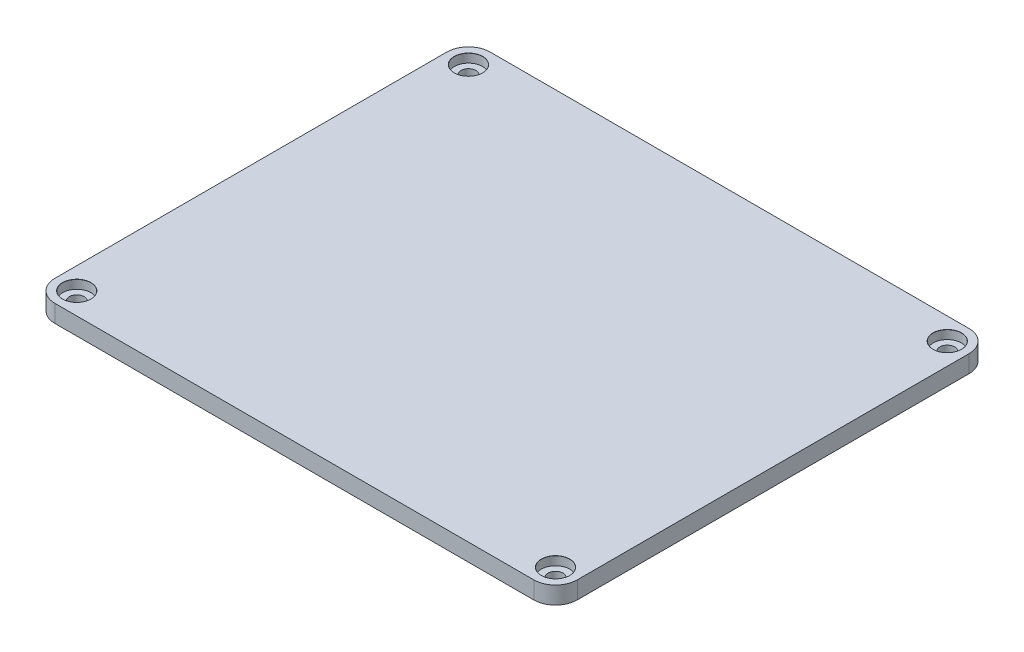
from build123d import *

# Parameters (mm, degrees)
SKETCH1_W      = 120
SKETCH1_H      = 100
BODY_DEPTH     = 4
EDGE_FILLETS_R = 5


# Read off the part's stored shape, not the designer's step: mounting_holes
with BuildPart() as part:
    # Sketch1 → body (new body)
    with BuildSketch(Plane(origin=(0, 0, 0), x_dir=(1, 0, 0), z_dir=(0, 1, 0))):
        Rectangle(SKETCH1_W, SKETCH1_H)
    extrude(amount=BODY_DEPTH)

    # mounting_holes outline → mounting_holes (revolve, cut)
    with BuildSketch(Plane(origin=(55, 0, 45), x_dir=(1, 0, 0), z_dir=(0, 0, 1))):
        Polygon((0, 0), (1.7, 0), (1.7, 2), (3.25, 2), (3.25, 3.975), (3.275, 4), (0, 4), align=None)
    revolve(axis=Axis((55, 0, 45), (0, 1, 0)), mode=Mode.SUBTRACT)

    # mounting_holes 2 outline → mounting_holes 2 (revolve, cut)
    with BuildSketch(Plane(origin=(-55, 0, -45), x_dir=(1, 0, 0), z_dir=(0, 0, 1))):
        Polygon((0, 4), (0, 0), (1.7, 0), (1.7, 2), (3.25, 2), (3.25, 3.975), (3.275, 4), align=None)
    revolve(axis=Axis((-55, 0, -45), (0, 1, 0)), mode=Mode.SUBTRACT)

    # mounting_holes 3 outline → mounting_holes 3 (revolve, cut)
    with BuildSketch(Plane(origin=(55, 0, -45), x_dir=(1, 0, 0), z_dir=(0, 0, 1))):
        Polygon((0, 4), (0, 0), (1.7, 0), (1.7, 2), (3.25, 2), (3.25, 3.975), (3.275, 4), align=None)
    revolve(axis=Axis((55, 0, -45), (0, 1, 0)), mode=Mode.SUBTRACT)

    # mounting_holes 4 outline → mounting_holes 4 (revolve, cut)
    with BuildSketch(Plane(origin=(-55, 0, 45), x_dir=(1, 0, 0), z_dir=(0, 0, 1))):
        Polygon((0, 4), (0, 0), (1.7, 0), (1.7, 2), (3.25, 2), (3.25, 3.975), (3.275, 4), align=None)
    revolve(axis=Axis((-55, 0, 45), (0, 1, 0)), mode=Mode.SUBTRACT)

    # edge_fillets
    edge_fillets_edges = [part.edges().sort_by_distance(p)[0] for p in [
        (60, 2, 50),
        (-60, 2, 50),
        (-60, 2, -50),
        (60, 2, -50),
    ]]
    fillet(edge_fillets_edges, radius=EDGE_FILLETS_R)


solid = part.part
